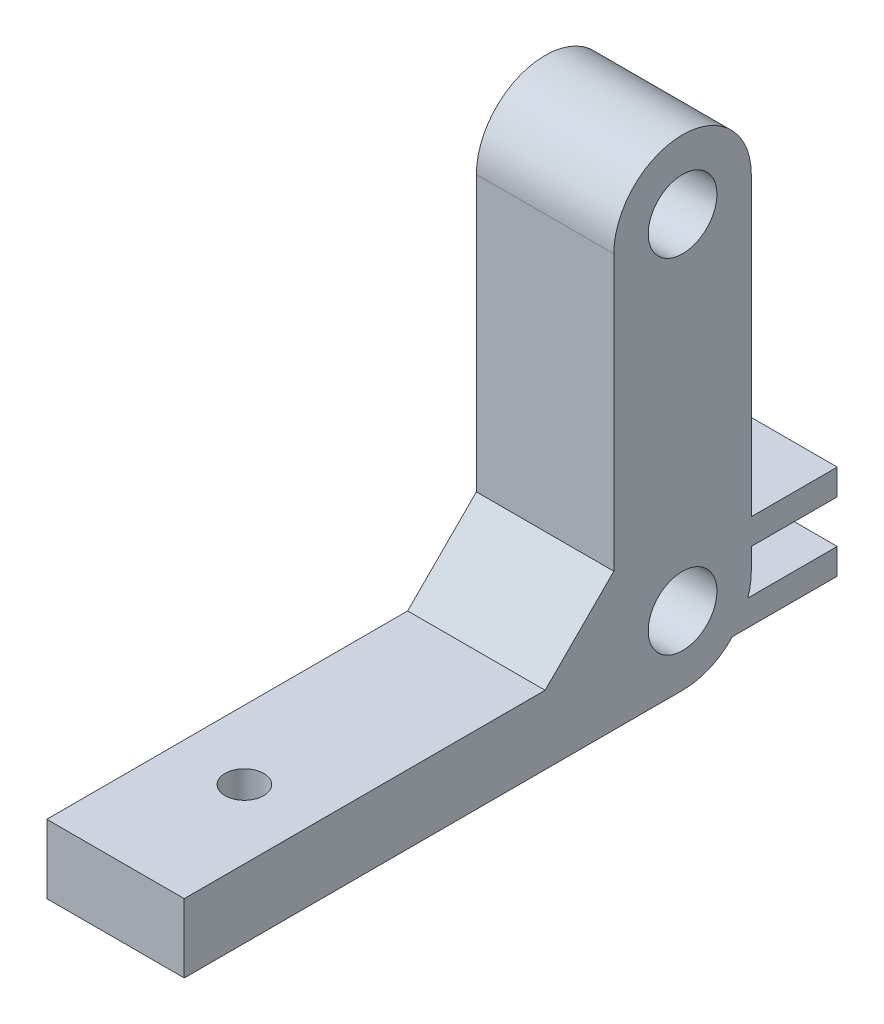
from build123d import *

# Parameters (mm, degrees)
SKETCH1_R           = 4
BOSS_EXTRUDE1_DEPTH = 16
SKETCH2_R           = 2.25
CUT_EXTRUDE1_DEPTH  = 78.710493114
SKETCH3_R           = 1.75
CUT_EXTRUDE2_DEPTH  = 75.439040429


with BuildPart() as part:
    # Sketch1 → Boss-Extrude1 (new body)
    with BuildSketch(Plane(origin=(0, 0, 0), x_dir=(0, 0, -1), z_dir=(1, 0, 0))):
        with BuildLine():
            Line((-10.309088451, -58.789851982), (-58.982376521, -58.789851982))
            Line((-58.982376521, -58.789851982), (-58.982376521, -50.789851982))
            Line((-58.982376521, -50.789851982), (-16.982376521, -50.789851982))
            Line((-16.982376521, -50.789851982), (-8.982376521, -42.789851982))
            Line((-8.982376521, -42.789851982), (-8.982376521, -10.789851982))
            ThreePointArc((-8.982376521, -10.789851982), (-0.982376521, -2.789851982), (7.017623479, -10.789851982))
            Line((7.017623479, -10.789851982), (7.017623479, -45.289851982))
            Line((7.017623479, -45.289851982), (17.017623479, -45.289851982))
            Line((17.017623479, -45.289851982), (17.017623479, -48.289851982))
            Line((17.017623479, -48.289851982), (7.017623479, -48.289851982))
            Line((7.017623479, -48.289851982), (7.017623479, -50.789851982))
            ThreePointArc((7.017623479, -50.789851982), (6.916823965, -52.055802887), (6.616965556, -53.289851982))
            Line((6.616965556, -53.289851982), (17.017623479, -53.289851982))
            Line((17.017623479, -53.289851982), (17.017623479, -56.289851982))
            Line((17.017623479, -56.289851982), (4.827098499, -56.289851982))
            ThreePointArc((4.827098499, -56.289851982), (2.179901139, -58.138321211), (-0.982376521, -58.789851982))
            Line((-0.982376521, -58.789851982), (-10.309088451, -58.789851982))
        make_face()
        with Locations((-0.982376521, -10.789851982)):
            Circle(SKETCH1_R, mode=Mode.SUBTRACT)
        with Locations((-0.982376521, -50.789851982)):
            Circle(SKETCH1_R, mode=Mode.SUBTRACT)
    extrude(amount=-BOSS_EXTRUDE1_DEPTH)

    # Sketch2 → Cut-Extrude1 (cut, through all)
    with BuildSketch(Plane(origin=(0, -50.789851982, 0), x_dir=(1, 0, 0), z_dir=(0, 1, 0))):
        with Locations((-8, -43.982376521)):
            Circle(SKETCH2_R)
    extrude(amount=-CUT_EXTRUDE1_DEPTH, mode=Mode.SUBTRACT)

    # Sketch3 → Cut-Extrude2 (cut, through all)
    with BuildSketch(Plane(origin=(0, -45.289851982, 0), x_dir=(1, 0, 0), z_dir=(0, 1, 0))):
        with Locations((-8, 12.017623479)):
            Circle(SKETCH3_R)
    extrude(amount=-CUT_EXTRUDE2_DEPTH, mode=Mode.SUBTRACT)


solid = part.part
